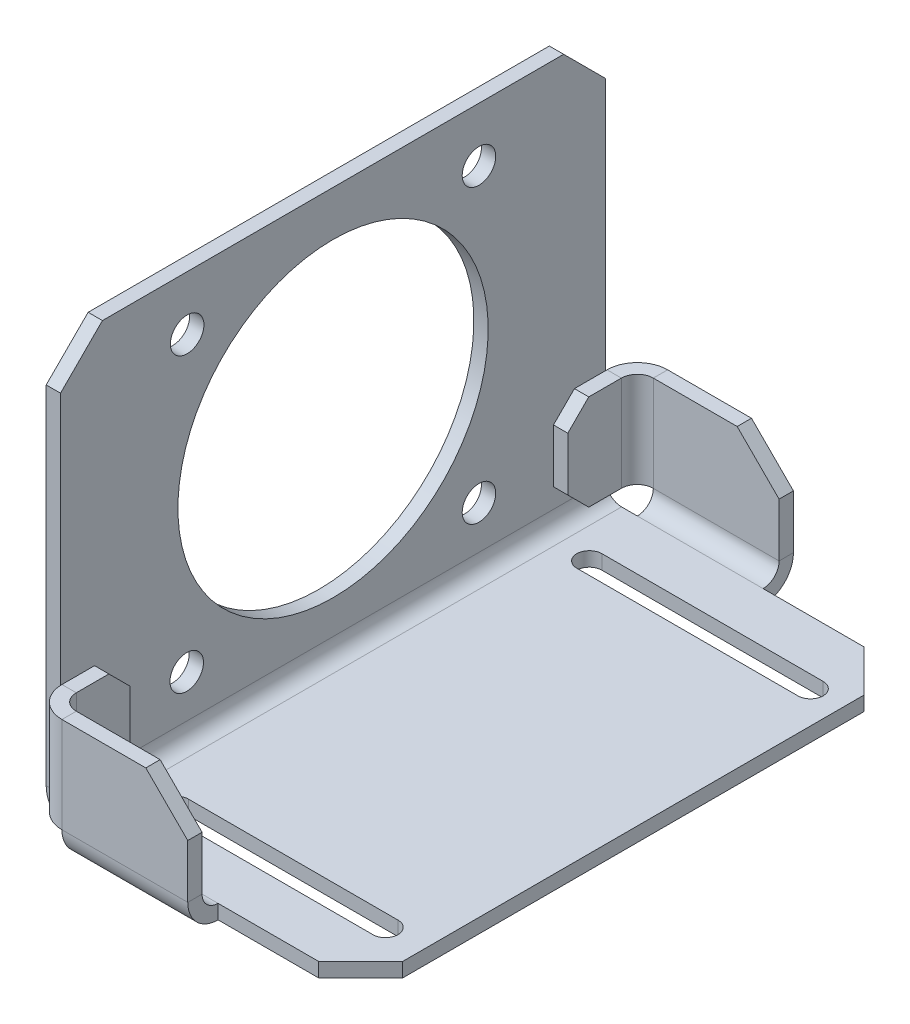
from build123d import *

# Parameters (mm, degrees)
SKETCH1_W                    = 75
SKETCH1_H                    = 130
BASE_FLANGE1_DEPTH           = 3.4163
EDGE_FLANGE1_STRIP_W         = 21.2852
EDGE_FLANGE1_STRIP_H         = 3.4163
EDGE_FLANGE1_STRIP_CUT_DEPTH = 130
EDGE_FLANGE1_DEPTH           = 130
SKETCH18_R                   = 37
SKETCH18_R_2                 = 4
CUT_EXTRUDE1_DEPTH           = 10
BREAK_CORNER1_DEPTH          = 3.4163
BREAK_CORNER2_START          = -3.4163
BREAK_CORNER2_DEPTH          = 3.4163
CUT_EXTRUDE2_DEPTH           = 10
EDGE_FLANGE2_DEPTH           = 30
EDGE_FLANGE3_DEPTH           = 22.7737
EDGE_FLANGE4_DEPTH           = 30
EDGE_FLANGE5_DEPTH           = 22.7737
BREAK_CORNER3_START          = 40.708137393
BREAK_CORNER3_OUTLINE_W      = 17
BREAK_CORNER3_OUTLINE_H      = 3.4163
BREAK_CORNER3_DEPTH          = 7.071067812
BREAK_CORNER4_START          = 3.76
BREAK_CORNER4_DEPTH          = 3.4163


# Read off the part's stored shape, not the designer's step: Break-Corner1, Break-Corner2, Break-Corner3, Break-Corner4
# Sheet-metal steps are written as plain solids
with BuildPart() as part:
    # Sketch1 → Base-Flange1 (new body)
    with BuildSketch(Plane(origin=(0, 0, 0), x_dir=(1, 0, 0), z_dir=(0, 1, 0))):
        with Locations((37.5, 65)):
            Rectangle(SKETCH1_W, SKETCH1_H)
    extrude(amount=-BASE_FLANGE1_DEPTH)

    # Edge-Flange1 strip (across the edge) → Edge-Flange1 strip cut (cut)
    with BuildSketch(Plane.XY.offset(-130)):
        with Locations((-3.4163, -1.70815)):
            Rectangle(EDGE_FLANGE1_STRIP_W, EDGE_FLANGE1_STRIP_H)
    extrude(amount=EDGE_FLANGE1_STRIP_CUT_DEPTH, mode=Mode.SUBTRACT)

    # Edge-Flange1 section (across the edge) → Edge-Flange1 (add)
    with BuildSketch(Plane.XY.offset(-130)):
        with BuildLine():
            Line((0, 3.81), (0, 96.5837))
            Line((0, 96.5837), (3.4163, 96.5837))
            Line((3.4163, 96.5837), (3.4163, 3.81))
            ThreePointArc((3.4163, 3.81), (4.532223164, 1.115923164), (7.2263, 0))
            Line((7.2263, 0), (7.2263, -3.4163))
            ThreePointArc((7.2263, -3.4163), (2.116534267, -1.299765733), (0, 3.81))
        make_face()
    extrude(amount=EDGE_FLANGE1_DEPTH)

    # Sketch18 → Cut-Extrude1 (cut)
    with BuildSketch(Plane.ZY):
        with Locations(Location((-65, 48.8287, 0), (0, 0, 270))):
            Circle(SKETCH18_R)
        with Locations(Location((-99.8, 83.6287, 0), (0, 0, 270))):
            Circle(SKETCH18_R_2)
        with Locations(Location((-30.2, 83.6287, 0), (0, 0, 270))):
            Circle(SKETCH18_R_2)
        with Locations(Location((-30.098341997, 13.953302375, 0), (0, 0, 270))):
            Circle(SKETCH18_R_2)
        with Locations(Location((-99.8, 14.0287, 0), (0, 0, 270))):
            Circle(SKETCH18_R_2)
    extrude(amount=-CUT_EXTRUDE1_DEPTH, mode=Mode.SUBTRACT)

    # Break-Corner1 outline → Break-Corner1 (cut)
    with BuildSketch(Plane.YZ):
        Polygon((96.5837, 0), (86.5837, 0), (96.5837, -10), align=None)
        Polygon((96.5837, -130), (96.5837, -120), (86.5837, -130), align=None)
    extrude(amount=BREAK_CORNER1_DEPTH, mode=Mode.SUBTRACT)

    # Break-Corner2 outline → Break-Corner2 (cut)
    with BuildSketch(Plane(origin=(0, 0, 0), x_dir=(1, 0, 0), z_dir=(0, 1, 0)).offset(BREAK_CORNER2_START)):
        Polygon((75, 0), (75, 10), (65, 0), align=None)
        Polygon((65, 130), (75, 120), (75, 130), align=None)
    extrude(amount=BREAK_CORNER2_DEPTH, mode=Mode.SUBTRACT)

    # Sketch19 → Cut-Extrude2 (cut)
    with BuildSketch(Plane(origin=(0, 0, 0), x_dir=(1, 0, 0), z_dir=(0, 1, 0))):
        with BuildLine():
            Line((67.28653865, 112), (14.54606135, 112))
            ThreePointArc((14.54606135, 112), (11.54606135, 115), (14.54606135, 118))
            Line((14.54606135, 118), (67.28653865, 118))
            ThreePointArc((67.28653865, 118), (70.28653865, 115), (67.28653865, 112))
        make_face()
        with BuildLine():
            Line((65.9163, 12), (15.9163, 12))
            ThreePointArc((15.9163, 12), (12.9163, 15), (15.9163, 18))
            Line((15.9163, 18), (65.9163, 18))
            ThreePointArc((65.9163, 18), (68.9163, 15), (65.9163, 12))
        make_face()
    extrude(amount=-CUT_EXTRUDE2_DEPTH, mode=Mode.SUBTRACT)

    # Edge-Flange2 section (across the edge) → Edge-Flange2 (add)
    with BuildSketch(Plane(origin=(10.9863, 0, 3.81), x_dir=(0, 0, -1), z_dir=(1, 0, 0))):
        with BuildLine():
            Line((-3.4163, 3.81), (-3.4163, 26.5837))
            Line((-3.4163, 26.5837), (0, 26.5837))
            Line((0, 26.5837), (0, 3.81))
            ThreePointArc((0, 3.81), (1.115923164, 1.115923164), (3.81, 0))
            Line((3.81, 0), (3.81, -3.4163))
            ThreePointArc((3.81, -3.4163), (-1.299765733, -1.299765733), (-3.4163, 3.81))
        make_face()
    extrude(amount=EDGE_FLANGE2_DEPTH)

    # Edge-Flange3 section (across the edge) → Edge-Flange3 (add)
    with BuildSketch(Plane(origin=(7.1763, 3.81, 3.81), x_dir=(1, 0, 0), z_dir=(0, 1, 0))):
        with BuildLine():
            Line((-3.4163, 3.81), (-3.4163, 16.5837))
            Line((-3.4163, 16.5837), (0, 16.5837))
            Line((0, 16.5837), (0, 3.81))
            ThreePointArc((0, 3.81), (1.115923164, 1.115923164), (3.81, 0))
            Line((3.81, 0), (3.81, -3.4163))
            ThreePointArc((3.81, -3.4163), (-1.299765733, -1.299765733), (-3.4163, 3.81))
        make_face()
    extrude(amount=EDGE_FLANGE3_DEPTH)

    # Edge-Flange4 section (across the edge) → Edge-Flange4 (add)
    with BuildSketch(Plane(origin=(40.9863, 0, -133.81), x_dir=(0, 0, 1), z_dir=(-1, 0, 0))):
        with BuildLine():
            Line((-3.4163, 3.81), (-3.4163, 26.5837))
            Line((-3.4163, 26.5837), (0, 26.5837))
            Line((0, 26.5837), (0, 3.81))
            ThreePointArc((0, 3.81), (1.115923164, 1.115923164), (3.81, 0))
            Line((3.81, 0), (3.81, -3.4163))
            ThreePointArc((3.81, -3.4163), (-1.299765733, -1.299765733), (-3.4163, 3.81))
        make_face()
    extrude(amount=EDGE_FLANGE4_DEPTH)

    # Edge-Flange5 section (across the edge) → Edge-Flange5 (add)
    with BuildSketch(Plane(origin=(7.1763, 26.5837, -133.81), x_dir=(1, 0, 0), z_dir=(0, -1, 0))):
        with BuildLine():
            Line((-3.4163, 3.81), (-3.4163, 16.5837))
            Line((-3.4163, 16.5837), (0, 16.5837))
            Line((0, 16.5837), (0, 3.81))
            ThreePointArc((0, 3.81), (1.115923164, 1.115923164), (3.81, 0))
            Line((3.81, 0), (3.81, -3.4163))
            ThreePointArc((3.81, -3.4163), (-1.299765733, -1.299765733), (-3.4163, 3.81))
        make_face()
    extrude(amount=EDGE_FLANGE5_DEPTH)

    # Break-Corner3 outline → Break-Corner3 (cut)
    with BuildSketch(Plane(origin=(0, 0, 0), x_dir=(0.7071067811865471, -0.707106781186548, 0), z_dir=(0.707106781186548, 0.707106781186547, 0)).offset(BREAK_CORNER3_START)):
        with Locations((10.5, -5.51815)):
            Rectangle(BREAK_CORNER3_OUTLINE_W, BREAK_CORNER3_OUTLINE_H)
        with Locations((10.5, 135.51815)):
            Rectangle(BREAK_CORNER3_OUTLINE_W, BREAK_CORNER3_OUTLINE_H)
    extrude(amount=BREAK_CORNER3_DEPTH, mode=Mode.SUBTRACT)

    # Break-Corner4 outline → Break-Corner4 (cut)
    with BuildSketch(Plane.YZ.offset(BREAK_CORNER4_START)):
        Polygon((3.81, -12.7737), (8.81, -12.7737), (3.81, -7.7737), align=None)
        Polygon((26.5837, -7.7737), (21.5837, -12.7737), (26.5837, -12.7737), align=None)
        Polygon((26.5837, -117.2263), (21.5837, -117.2263), (26.5837, -122.2263), align=None)
        Polygon((3.81, -122.2263), (8.81, -117.2263), (3.81, -117.2263), align=None)
    extrude(amount=BREAK_CORNER4_DEPTH, mode=Mode.SUBTRACT)


solid = part.part
